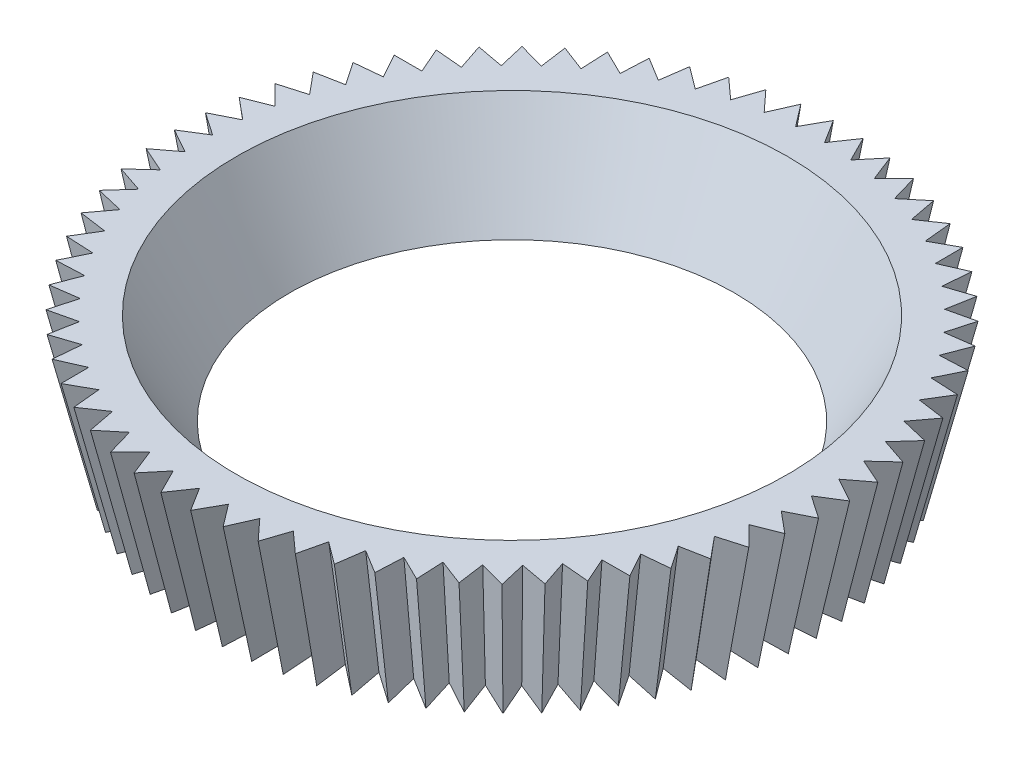
from build123d import *

# Parameters (mm, degrees)
CUT_EXTRUDE1_DEPTH = 12.754719772
CUT_EXTRUDE1_TAPER = -7
CIRPATTERN1_COUNT  = 68


with BuildPart() as part:
    # Sketch1 → Revolve1 (revolve)
    with BuildSketch(Plane.XY):
        Polygon((7.024519053, 11.810417438), (8, 13.5), (8, 15), (6.5, 15), (5.25, 12.834936491), align=None)
    revolve(axis=Axis((0, 11.810417438, 0), (0, 1, 0)))

    # Sketch2 → Cut-Extrude1 (cut, through all)
    with BuildSketch(Plane(origin=(0, 15, 0), x_dir=(1, 0, 0), z_dir=(0, 1, 0))):
        with BuildLine():
            ThreePointArc((0.065685087, -7.999730337), (0.566798795, -7.979895935), (1.065685087, -7.928701993))
            Line((1.065685087, -7.928701993), (0.511510951, -7.201504649))
            Line((0.511510951, -7.201504649), (0.065685087, -7.999730337))
        make_face()
    cut_extrude1 = extrude(amount=-CUT_EXTRUDE1_DEPTH, taper=CUT_EXTRUDE1_TAPER, mode=Mode.SUBTRACT)

    # CirPattern1: Cut-Extrude1 ×68 about axis
    cirpattern1_axis = Axis((0, 15, 0), (0, -1, 0))
    for i in range(1, CIRPATTERN1_COUNT):
        add(cut_extrude1.rotate(cirpattern1_axis, i * 360 / CIRPATTERN1_COUNT), mode=Mode.SUBTRACT)


solid = part.part
